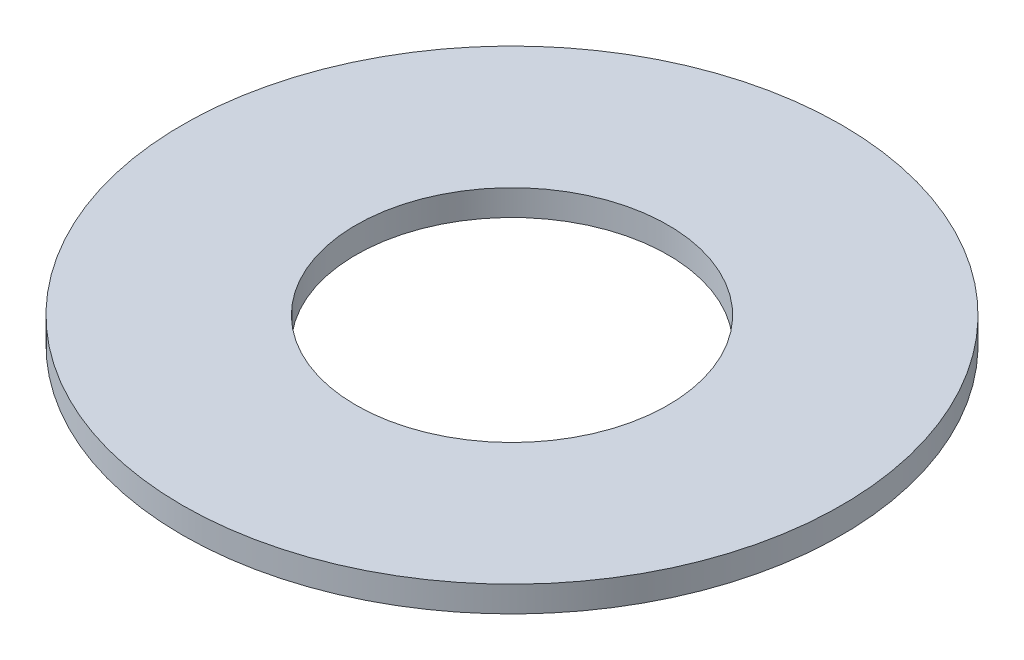
from build123d import *

# Parameters (mm, degrees)
SKETCH1_R           = 10.0584
SKETCH1_R_2         = 4.7625
BOSS_EXTRUDE1_DEPTH = 0.7874


with BuildPart() as part:
    # Sketch1 → Boss-Extrude1 (new body)
    with BuildSketch(Plane(origin=(0, 0, 0), x_dir=(1, 0, 0), z_dir=(0, 1, 0))):
        Circle(SKETCH1_R)
        Circle(SKETCH1_R_2, mode=Mode.SUBTRACT)
    extrude(amount=BOSS_EXTRUDE1_DEPTH)


solid = part.part
